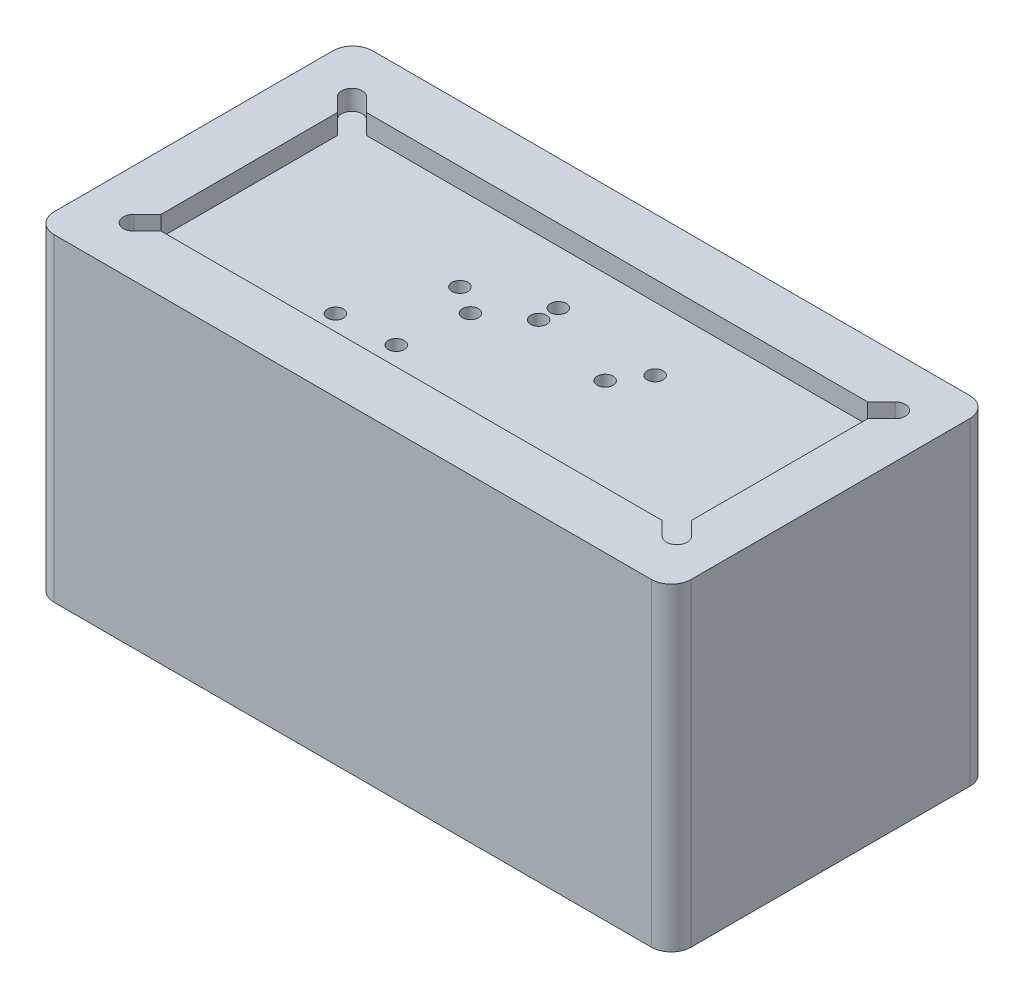
from build123d import *

# Parameters (mm, degrees)
SKETCH1_W           = 50.8
SKETCH1_H           = 25.4
BOSS_EXTRUDE1_DEPTH = 25.4
SKETCH6_R           = 0.635
CUT_EXTRUDE1_DEPTH  = 39.1
CUT_EXTRUDE2_DEPTH  = 1.5875
CUT_EXTRUDE3_DEPTH  = 3.175
FILLET1_R           = 3.302
FILLET2_R           = 0.8128
CHAMFER1_SIZE       = 0.635
FILLET3_R           = 1.5875


with BuildPart() as part:
    # Sketch1 → Boss-Extrude1 (new body)
    with BuildSketch(Plane(origin=(0, 0, 0), x_dir=(1, 0, 0), z_dir=(0, 1, 0))):
        Rectangle(SKETCH1_W, SKETCH1_H)
    extrude(amount=BOSS_EXTRUDE1_DEPTH)

    # Sketch6 → Cut-Extrude1 (cut, through all)
    with BuildSketch(Plane(origin=(0, 25.4, 0), x_dir=(1, 0, 0), z_dir=(0, 1, 0))):
        with Locations(Location((-5.6134, 1.4605, 0), (0, 0, 270))):
            Circle(SKETCH6_R)
        with Locations(Location((-0.2286, 3.9243, 0), (0, 0, 270))):
            Circle(SKETCH6_R)
        with Locations(Location((-0.2032, 2.3241, 0), (0, 0, 270))):
            Circle(SKETCH6_R)
        with Locations(Location((-4.1402, -5.0927, 0), (0, 0, 270))):
            Circle(SKETCH6_R)
        with Locations(Location((-8.7376, -5.3467, 0), (0, 0, 270))):
            Circle(SKETCH6_R)
        with Locations(Location((6.6548, 0.7747, 0), (0, 0, 270))):
            Circle(SKETCH6_R)
        with Locations(Location((8.2804, 3.1369, 0), (0, 0, 270))):
            Circle(SKETCH6_R)
        with Locations(Location((-3.3782, 0.0635, 0), (0, 0, 270))):
            Circle(SKETCH6_R)
    extrude(amount=-CUT_EXTRUDE1_DEPTH, mode=Mode.SUBTRACT)

    # Sketch7 → Cut-Extrude2 (cut)
    with BuildSketch(Plane(origin=(0, 25.4, 0), x_dir=(1, 0, 0), z_dir=(0, 1, 0))):
        with BuildLine():
            Line((-20.955, -7.024066704), (-20.955, 7.024066704))
            Line((-20.955, 7.024066704), (-22.046716648, 8.115783352))
            ThreePointArc((-22.046716648, 8.115783352), (-22.046716648, 9.283216648), (-20.879283352, 9.283216648))
            Line((-20.879283352, 9.283216648), (-19.787566704, 8.1915))
            Line((-19.787566704, 8.1915), (20.168566704, 8.1915))
            Line((20.168566704, 8.1915), (21.260283352, 9.283216648))
            ThreePointArc((21.260283352, 9.283216648), (22.427716648, 9.283216648), (22.427716648, 8.115783352))
            Line((22.427716648, 8.115783352), (21.336, 7.024066704))
            Line((21.336, 7.024066704), (21.336, -7.024066704))
            Line((21.336, -7.024066704), (22.427716648, -8.115783352))
            ThreePointArc((22.427716648, -8.115783352), (22.427716648, -9.283216648), (21.260283352, -9.283216648))
            Line((21.260283352, -9.283216648), (20.168566704, -8.1915))
            Line((20.168566704, -8.1915), (-19.787566704, -8.1915))
            Line((-19.787566704, -8.1915), (-20.879283352, -9.283216648))
            ThreePointArc((-20.879283352, -9.283216648), (-22.046716648, -9.283216648), (-22.046716648, -8.115783352))
            Line((-22.046716648, -8.115783352), (-20.955, -7.024066704))
        make_face()
    extrude(amount=-CUT_EXTRUDE2_DEPTH, mode=Mode.SUBTRACT)

    # Sketch8 → Cut-Extrude3 (cut)
    with BuildSketch(Plane.XZ):
        Polygon((22.86, 10.16), (-22.86, 10.16), (-22.86, 3.175), (-25.4, 3.175), (-25.4, -3.175), (-22.86, -3.175), (-22.86, -10.16), (22.86, -10.16), align=None)
    extrude(amount=-CUT_EXTRUDE3_DEPTH, mode=Mode.SUBTRACT)

    # Fillet1
    fillet1_edges = [part.edges().sort_by_distance(p)[0] for p in [
        (22.86, 1.5875, 10.16),
        (22.86, 1.5875, -10.16),
        (-22.86, 1.5875, -10.16),
        (-22.86, 1.5875, 10.16),
    ]]
    fillet(fillet1_edges, radius=FILLET1_R)

    # Fillet2
    fillet2_edges = [part.edges().sort_by_distance(p)[0] for p in [
        (-22.86, 1.5875, -3.175),
        (-22.86, 1.5875, 3.175),
    ]]
    fillet(fillet2_edges, radius=FILLET2_R)

    # Chamfer1
    # the kernel refuses this chamfer: 0.635 mm, written as the material it takes off along each edge
    with BuildSketch(Plane(origin=(-5.6134, 3.175, -1.4605), x_dir=(0, 0, 1), z_dir=(-1, 0, 0))) as chamfer1_piece_1:
        Polygon((0.635 + CHAMFER1_SIZE, 0), (0.635, CHAMFER1_SIZE), (0.635, 0), align=None)
    revolve(axis=Axis((-5.6134, 3.175, -1.4605), (0, 1, 0)), mode=Mode.SUBTRACT)
    with BuildSketch(Plane(origin=(-0.2286, 3.175, -3.9243), x_dir=(0, 0, 1), z_dir=(-1, 0, 0))) as chamfer1_piece_2:
        Polygon((0.635 + CHAMFER1_SIZE, 0), (0.635, CHAMFER1_SIZE), (0.635, 0), align=None)
    revolve(axis=Axis((-0.2286, 3.175, -3.9243), (0, 1, 0)), mode=Mode.SUBTRACT)
    with BuildSketch(Plane(origin=(-0.2032, 3.175, -2.3241), x_dir=(0, 0, 1), z_dir=(-1, 0, 0))) as chamfer1_piece_3:
        Polygon((0.635 + CHAMFER1_SIZE, 0), (0.635, CHAMFER1_SIZE), (0.635, 0), align=None)
    revolve(axis=Axis((-0.2032, 3.175, -2.3241), (0, 1, 0)), mode=Mode.SUBTRACT)
    with BuildSketch(Plane(origin=(-4.1402, 3.175, 5.0927), x_dir=(0, 0, 1), z_dir=(-1, 0, 0))) as chamfer1_piece_4:
        Polygon((0.635 + CHAMFER1_SIZE, 0), (0.635, CHAMFER1_SIZE), (0.635, 0), align=None)
    revolve(axis=Axis((-4.1402, 3.175, 5.0927), (0, 1, 0)), mode=Mode.SUBTRACT)
    with BuildSketch(Plane(origin=(-8.7376, 3.175, 5.3467), x_dir=(0, 0, 1), z_dir=(-1, 0, 0))) as chamfer1_piece_5:
        Polygon((0.635 + CHAMFER1_SIZE, 0), (0.635, CHAMFER1_SIZE), (0.635, 0), align=None)
    revolve(axis=Axis((-8.7376, 3.175, 5.3467), (0, 1, 0)), mode=Mode.SUBTRACT)
    with BuildSketch(Plane(origin=(6.6548, 3.175, -0.7747), x_dir=(0, 0, 1), z_dir=(-1, 0, 0))) as chamfer1_piece_6:
        Polygon((0.635 + CHAMFER1_SIZE, 0), (0.635, CHAMFER1_SIZE), (0.635, 0), align=None)
    revolve(axis=Axis((6.6548, 3.175, -0.7747), (0, 1, 0)), mode=Mode.SUBTRACT)
    with BuildSketch(Plane(origin=(8.2804, 3.175, -3.1369), x_dir=(0, 0, 1), z_dir=(-1, 0, 0))) as chamfer1_piece_7:
        Polygon((0.635 + CHAMFER1_SIZE, 0), (0.635, CHAMFER1_SIZE), (0.635, 0), align=None)
    revolve(axis=Axis((8.2804, 3.175, -3.1369), (0, 1, 0)), mode=Mode.SUBTRACT)
    with BuildSketch(Plane(origin=(-3.3782, 3.175, -0.0635), x_dir=(0, 0, 1), z_dir=(-1, 0, 0))) as chamfer1_piece_8:
        Polygon((0.635 + CHAMFER1_SIZE, 0), (0.635, CHAMFER1_SIZE), (0.635, 0), align=None)
    revolve(axis=Axis((-3.3782, 3.175, -0.0635), (0, 1, 0)), mode=Mode.SUBTRACT)

    # Fillet3
    fillet3_edges = [part.edges().sort_by_distance(p)[0] for p in [
        (-25.4, 12.7, -12.7),
        (25.4, 12.7, -12.7),
        (25.4, 12.7, 12.7),
        (-25.4, 12.7, 12.7),
    ]]
    fillet(fillet3_edges, radius=FILLET3_R)


solid = part.part
